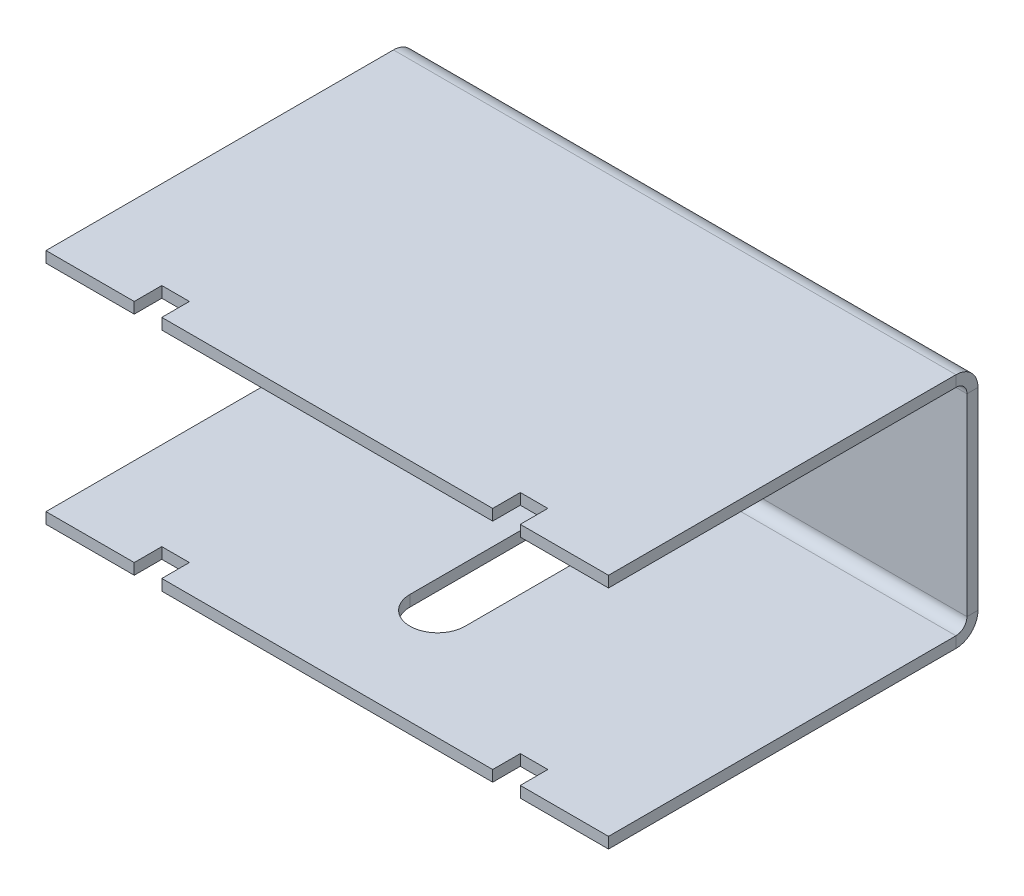
from build123d import *

# Parameters (mm, degrees)
SM_BASE_FLANGE_1_DEPTH = 51
CUT_EXTRUDE_1_REACH    = 77.102
SKETCH_3_W             = 5
SKETCH_3_H             = 10
CUT_EXTRUDE_2_DEPTH    = 76.101597853


# Sheet-metal steps are written as plain solids
with BuildPart() as part:
    # Sketch 1 → 基体-法兰1 (new, symmetric)
    with BuildSketch(Plane(origin=(0, 0, 0), x_dir=(0, 0, -1), z_dir=(1, 0, 0))):
        with BuildLine():
            Line((-32.5, -19.5), (30.5, -19.5))
            ThreePointArc((30.5, -19.5), (31.914213562, -18.914213562), (32.5, -17.5))
            Line((32.5, -17.5), (32.5, 17.5))
            ThreePointArc((32.5, 17.5), (31.914213562, 18.914213562), (30.5, 19.5))
            Line((30.5, 19.5), (-32.5, 19.5))
            Line((-32.5, 19.5), (-32.5, 21.5))
            Line((-32.5, 21.5), (30.5, 21.5))
            ThreePointArc((30.5, 21.5), (33.328427125, 20.328427125), (34.5, 17.5))
            Line((34.5, 17.5), (34.5, -17.5))
            ThreePointArc((34.5, -17.5), (33.328427125, -20.328427125), (30.5, -21.5))
            Line((30.5, -21.5), (-32.5, -21.5))
            Line((-32.5, -21.5), (-32.5, -19.5))
        make_face()
    extrude(amount=SM_BASE_FLANGE_1_DEPTH, both=True)

    # Sketch 2 → 切除-拉伸1 (cut, up to next)
    with BuildSketch(Plane.XZ.offset(21.5), mode=Mode.PRIVATE) as cut_extrude_1_sk1:
        with BuildLine():
            Line((5, 12.5), (5, -14.5))
            ThreePointArc((5, -14.5), (0, -19.5), (-5, -14.5))
            Line((-5, -14.5), (-5, 12.5))
            ThreePointArc((-5, 12.5), (0, 17.5), (5, 12.5))
        make_face()
    cut_extrude_1_tool1 = extrude(cut_extrude_1_sk1.sketch, amount=-CUT_EXTRUDE_1_REACH, mode=Mode.PRIVATE) & part.part
    add(cut_extrude_1_tool1.solids().sort_by_distance((0, -21.5, -1))[0], mode=Mode.SUBTRACT)

    # 草图3 → 切除-拉伸2 (cut, through all)
    with BuildSketch(Plane(origin=(0, 21.5, 0), x_dir=(1, 0, 0), z_dir=(0, 1, 0))):
        with Locations((-32.5, -32.5)):
            Rectangle(SKETCH_3_W, SKETCH_3_H)
        with Locations((32.5, -32.5)):
            Rectangle(SKETCH_3_W, SKETCH_3_H)
    extrude(amount=-CUT_EXTRUDE_2_DEPTH, mode=Mode.SUBTRACT)


solid = part.part
